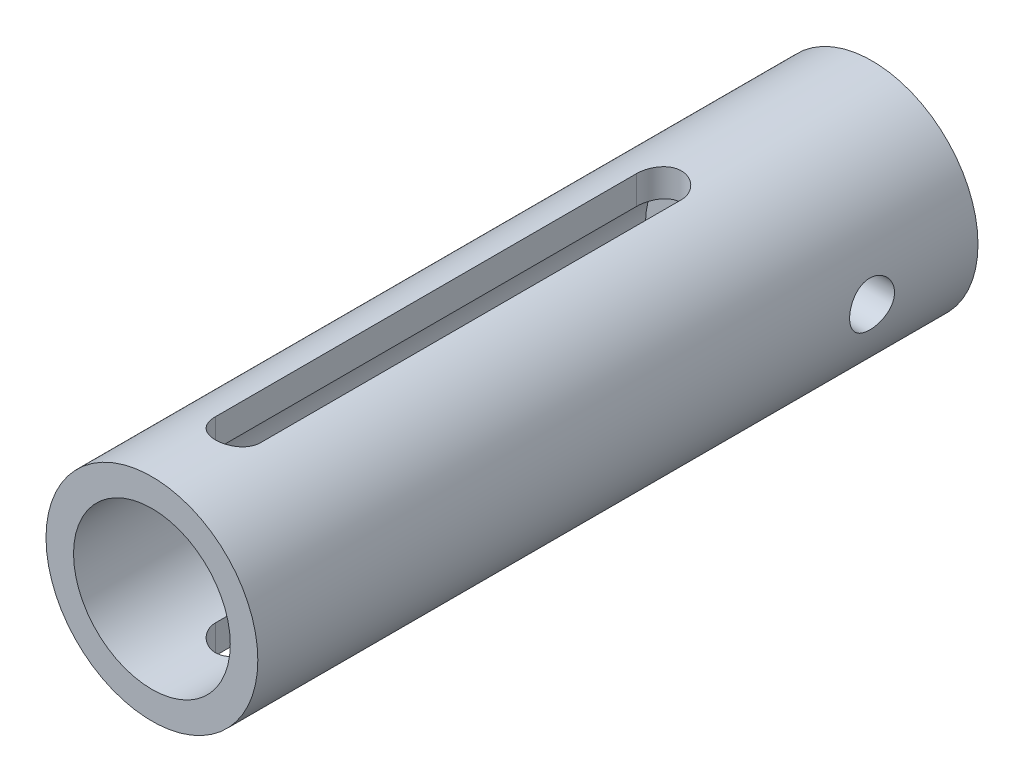
from build123d import *

# Parameters (mm, degrees)
SKETCH1_R                   = 15.875
SKETCH1_R_2                 = 11.7475
BOSS_EXTRUDE1_DEPTH         = 101.6
F_1_4_START                 = 10
F_1_4_CLEARANCE_SLOT1_DEPTH = 7
CUT_EXTRUDE1_REACH          = 106.051
CUT_EXTRUDE1_END_RADIUS     = 15.875
SKETCH7_R                   = 15.875
BOSS_EXTRUDE2_DEPTH         = 15.875
CUT_EXTRUDE3_DEPTH          = 105.050907141
CUT_EXTRUDE3_DEPTH_BACK     = 105.050907141
SKETCH6_R                   = 3.3655
BOSS_EXTRUDE3_START         = 6.35
SKETCH8_R                   = 15.875
BOSS_EXTRUDE3_DEPTH         = 6.35


with BuildPart() as part:
    # Sketch1 → Boss-Extrude1 (new body)
    with BuildSketch(Plane.XY):
        Circle(SKETCH1_R)
        Circle(SKETCH1_R_2, mode=Mode.SUBTRACT)
    extrude(amount=BOSS_EXTRUDE1_DEPTH)

    # 1/4 Clearance Slot1: read off the stored shape, not the designer's step
    # 1/4 Clearance Slot1 outline → 1/4 Clearance Slot1 (cut)
    with BuildSketch(Plane(origin=(0, 0, 0), x_dir=(1, 0, 0), z_dir=(0, 1, 0)).offset(F_1_4_START)):
        with BuildLine():
            Line((3.3782, -88.6968), (3.3782, -25.6032))
            ThreePointArc((3.3782, -25.6032), (0, -22.225), (-3.3782, -25.6032))
            Line((-3.3782, -25.6032), (-3.3782, -88.6968))
            ThreePointArc((-3.3782, -88.6968), (0, -92.075), (3.3782, -88.6968))
        make_face()
    extrude(amount=F_1_4_CLEARANCE_SLOT1_DEPTH, mode=Mode.SUBTRACT)

    # Cut-Extrude1: up to this cylinder (the profile starts inside it)
    cut_extrude1_end = Plane(origin=(0, 0, 57.15), z_dir=(0, 0, -1)) * Cylinder(CUT_EXTRUDE1_END_RADIUS, 244.852, mode=Mode.PRIVATE)
    # Sketch4 → Cut-Extrude1 (cut, up to the surface)
    with BuildSketch(Plane(origin=(0, 0, 0), x_dir=(1, 0, 0), z_dir=(0, 1, 0)), mode=Mode.PRIVATE) as cut_extrude1_sk1:
        with BuildLine():
            Line((-3.3782, -88.6968), (-3.3782, -25.6032))
            ThreePointArc((-3.3782, -25.6032), (0, -22.225), (3.3782, -25.6032))
            Line((3.3782, -25.6032), (3.3782, -88.6968))
            ThreePointArc((3.3782, -88.6968), (0, -92.075), (-3.3782, -88.6968))
        make_face()
    cut_extrude1_tool1 = extrude(cut_extrude1_sk1.sketch, amount=-CUT_EXTRUDE1_REACH, mode=Mode.PRIVATE) & cut_extrude1_end
    add(cut_extrude1_tool1.solids().sort_by_distance((0, 0, 57.15))[0], mode=Mode.SUBTRACT)

    # Sketch7 → Boss-Extrude2 (add)
    with BuildSketch(Plane(origin=(0, 0, 0), x_dir=(-1, 0, 0), z_dir=(0, 0, -1))):
        with Locations(Location((0, 0, 0), (0, 0, 180))):
            Circle(SKETCH7_R)
    extrude(amount=-BOSS_EXTRUDE2_DEPTH)

    # Sketch6 → Cut-Extrude3 (cut, two sides: drawn at the far end of the back side and taken through both)
    with BuildSketch(Plane(origin=(0, 0, 0), x_dir=(0, 0, -1), z_dir=(1, 0, 0)).offset(-CUT_EXTRUDE3_DEPTH_BACK)):
        with Locations((-9.525, 0)):
            Circle(SKETCH6_R)
    extrude(amount=CUT_EXTRUDE3_DEPTH + CUT_EXTRUDE3_DEPTH_BACK, mode=Mode.SUBTRACT)

    # Sketch8 → Boss-Extrude3 (add)
    with BuildSketch(Plane(origin=(0, 0, 0), x_dir=(-1, 0, 0), z_dir=(0, 0, -1)).offset(BOSS_EXTRUDE3_START)):
        Circle(SKETCH8_R)
    extrude(amount=-BOSS_EXTRUDE3_DEPTH)


solid = part.part
